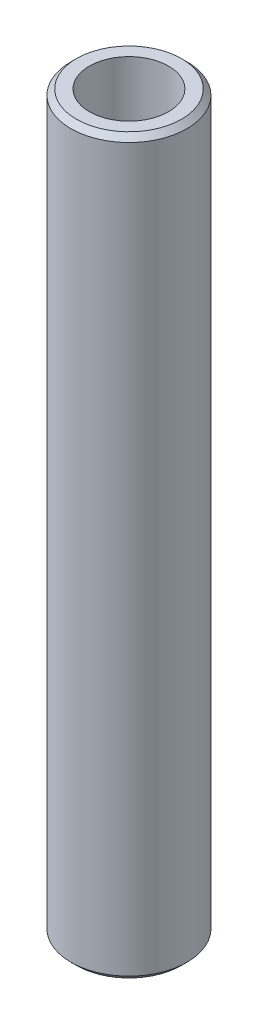
from build123d import *

# Parameters (mm, degrees)
SKETCH1_R           = 47.5
BOSS_EXTRUDE1_DEPTH = 600
SKETCH2_R           = 32.401200111
CUT_EXTRUDE1_DEPTH  = 604.748706003
CHAMFER1_SIZE       = 4.474818622


with BuildPart() as part:
    # Sketch1 → Boss-Extrude1 (new body)
    with BuildSketch(Plane(origin=(0, 0, 0), x_dir=(1, 0, 0), z_dir=(0, 1, 0))):
        Circle(SKETCH1_R)
    extrude(amount=BOSS_EXTRUDE1_DEPTH)

    # Sketch2 → Cut-Extrude1 (cut, through all)
    with BuildSketch(Plane(origin=(0, 0, 0), x_dir=(1, 0, 0), z_dir=(0, 1, 0))):
        Circle(SKETCH2_R)
    extrude(amount=CUT_EXTRUDE1_DEPTH, mode=Mode.SUBTRACT)

    # Chamfer1
    chamfer1_edges = [part.edges().sort_by_distance(p)[0] for p in [
        (-47.5, 600, 0),
        (-47.5, 0, 0),
    ]]
    chamfer(chamfer1_edges, length=CHAMFER1_SIZE)


solid = part.part
